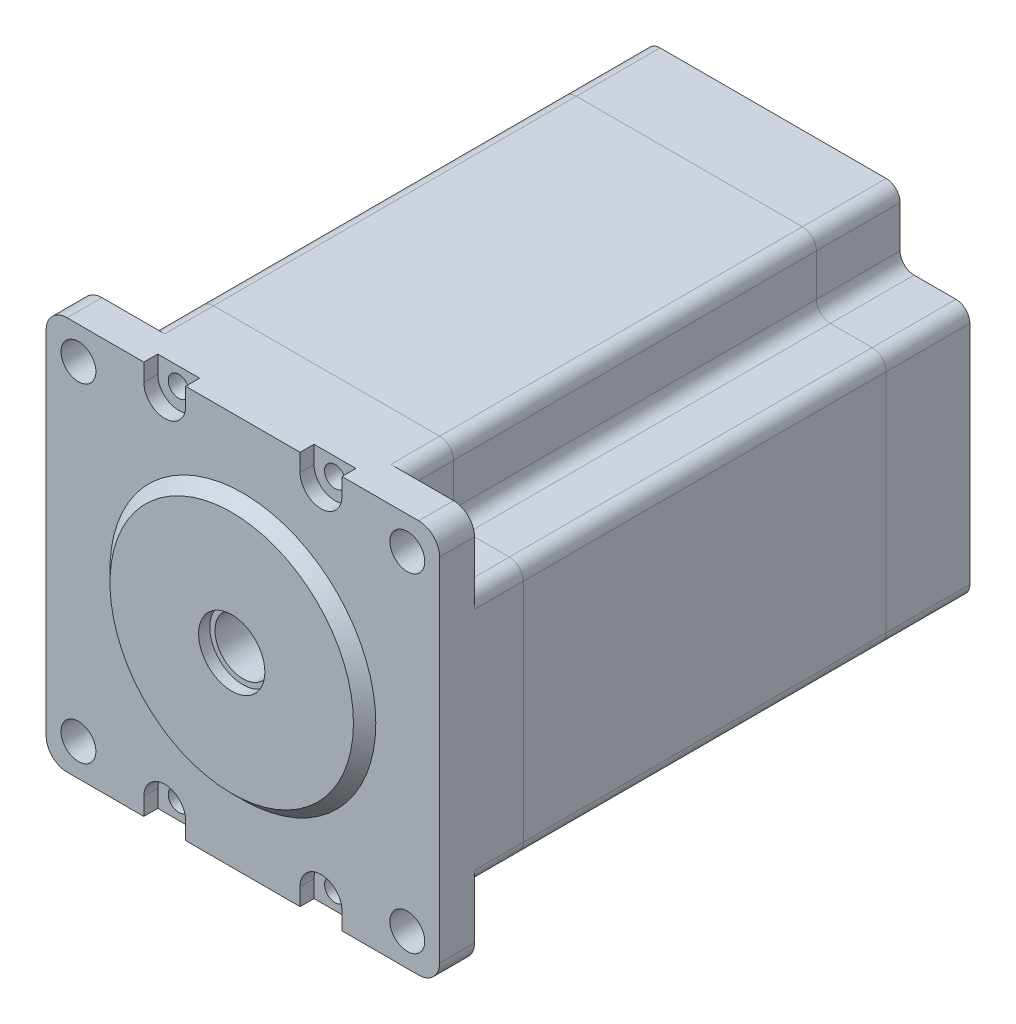
from build123d import *

# Parameters (mm, degrees)
IZIM2_R                     = 2.5
Y_KSEKLIK_EKSTR_ZYON1_DEPTH = 5
Y_KSEKLIK_EKSTR_ZYON2_DEPTH = 7
KES_EKSTR_ZYON1_DEPTH       = 2
IZIM6_R                     = 19.05
Y_KSEKLIK_EKSTR_ZYON3_DEPTH = 1.6
PAH1_SIZE                   = 1.6
Y_KSEKLIK_EKSTR_ZYON5_DEPTH = 52
Y_KSEKLIK_EKSTR_ZYON6_DEPTH = 12
IZIM10_R                    = 1.5
KES_EKSTR_ZYON3_DEPTH       = 10
KES_EKSTR_ZYON4_START       = -77.6
IZIM7_R                     = 4
KES_EKSTR_ZYON4_DEPTH       = 77.6
IZIM11_R                    = 4.75
KES_EKSTR_ZYON5_DEPTH       = 1.6


with BuildPart() as part:
    # Çizim2 → Yükseklik-Ekstrüzyon1 (new body)
    with BuildSketch(Plane.XY):
        with BuildLine():
            Line((-25.2, 28.2), (25.2, 28.2))
            ThreePointArc((25.2, 28.2), (27.321320344, 27.321320344), (28.2, 25.2))
            Line((28.2, 25.2), (28.2, -25.2))
            ThreePointArc((28.2, -25.2), (27.321320344, -27.321320344), (25.2, -28.2))
            Line((25.2, -28.2), (-25.2, -28.2))
            ThreePointArc((-25.2, -28.2), (-27.321320344, -27.321320344), (-28.2, -25.2))
            Line((-28.2, -25.2), (-28.2, 25.2))
            ThreePointArc((-28.2, 25.2), (-27.321320344, 27.321320344), (-25.2, 28.2))
        make_face()
        with Locations((-23.57, 23.57)):
            Circle(IZIM2_R, mode=Mode.SUBTRACT)
        with Locations((23.57, 23.57)):
            Circle(IZIM2_R, mode=Mode.SUBTRACT)
        with Locations(Location((23.57, -23.57, 0), (0, 0, 180))):
            Circle(IZIM2_R, mode=Mode.SUBTRACT)
        with Locations(Location((-23.57, -23.57, 0), (0, 0, 180))):
            Circle(IZIM2_R, mode=Mode.SUBTRACT)
    extrude(amount=Y_KSEKLIK_EKSTR_ZYON1_DEPTH)

    # Çizim4 → Yükseklik-Ekstrüzyon2 (add)
    with BuildSketch(Plane(origin=(0, 0, 0), x_dir=(-1, 0, 0), z_dir=(0, 0, -1))):
        with BuildLine():
            Line((-18.2, 26.2), (-18.2, 20.2))
            ThreePointArc((-18.2, 20.2), (-18.785786438, 18.785786438), (-20.2, 18.2))
            Line((-20.2, 18.2), (-26.2, 18.2))
            ThreePointArc((-26.2, 18.2), (-27.614213562, 17.614213562), (-28.2, 16.2))
            Line((-28.2, 16.2), (-28.2, -16.2))
            ThreePointArc((-28.2, -16.2), (-27.614213562, -17.614213562), (-26.2, -18.2))
            Line((-26.2, -18.2), (-20.2, -18.2))
            ThreePointArc((-20.2, -18.2), (-18.785786438, -18.785786438), (-18.2, -20.2))
            Line((-18.2, -20.2), (-18.2, -26.2))
            ThreePointArc((-18.2, -26.2), (-17.614213562, -27.614213562), (-16.2, -28.2))
            Line((-16.2, -28.2), (16.2, -28.2))
            ThreePointArc((16.2, -28.2), (17.614213562, -27.614213562), (18.2, -26.2))
            Line((18.2, -26.2), (18.2, -20.2))
            ThreePointArc((18.2, -20.2), (18.785786438, -18.785786438), (20.2, -18.2))
            Line((20.2, -18.2), (26.2, -18.2))
            ThreePointArc((26.2, -18.2), (27.614213562, -17.614213562), (28.2, -16.2))
            Line((28.2, -16.2), (28.2, 16.2))
            ThreePointArc((28.2, 16.2), (27.614213562, 17.614213562), (26.2, 18.2))
            Line((26.2, 18.2), (20.2, 18.2))
            ThreePointArc((20.2, 18.2), (18.785786438, 18.785786438), (18.2, 20.2))
            Line((18.2, 20.2), (18.2, 26.2))
            ThreePointArc((18.2, 26.2), (17.614213562, 27.614213562), (16.2, 28.2))
            Line((16.2, 28.2), (-16.2, 28.2))
            ThreePointArc((-16.2, 28.2), (-17.614213562, 27.614213562), (-18.2, 26.2))
        make_face()
    extrude(amount=Y_KSEKLIK_EKSTR_ZYON2_DEPTH)

    # Çizim5 → Kes-Ekstrüzyon1 (cut)
    with BuildSketch(Plane.XY.offset(5)):
        with BuildLine():
            Line((-14.2, 28.2), (-14.2, 25.7))
            ThreePointArc((-14.2, 25.7), (-11.2, 22.7), (-8.2, 25.7))
            Line((-8.2, 25.7), (-8.2, 28.2))
            Line((-8.2, 28.2), (-14.2, 28.2))
        make_face()
        with BuildLine():
            Line((-14.2, -28.2), (-8.2, -28.2))
            Line((-8.2, -28.2), (-8.2, -25.7))
            ThreePointArc((-8.2, -25.7), (-11.2, -22.7), (-14.2, -25.7))
            Line((-14.2, -25.7), (-14.2, -28.2))
        make_face()
        with BuildLine():
            Line((14.2, -28.2), (14.2, -25.7))
            ThreePointArc((14.2, -25.7), (11.2, -22.7), (8.2, -25.7))
            Line((8.2, -25.7), (8.2, -28.2))
            Line((8.2, -28.2), (14.2, -28.2))
        make_face()
        with BuildLine():
            Line((14.2, 28.2), (8.2, 28.2))
            Line((8.2, 28.2), (8.2, 25.7))
            ThreePointArc((8.2, 25.7), (11.2, 22.7), (14.2, 25.7))
            Line((14.2, 25.7), (14.2, 28.2))
        make_face()
    extrude(amount=-KES_EKSTR_ZYON1_DEPTH, mode=Mode.SUBTRACT)

    # Çizim10 → Kes-Ekstrüzyon3 (cut)
    with BuildSketch(Plane.XY.offset(3)):
        with Locations((-11.2, 25.7)):
            Circle(IZIM10_R)
        with Locations(Location((-11.2, -25.7, 0), (0, 0, 180))):
            Circle(IZIM10_R)
        with Locations((11.2, -25.7)):
            Circle(IZIM10_R)
        with Locations(Location((11.2, 25.7, 0), (0, 0, 180))):
            Circle(IZIM10_R)
    extrude(amount=-KES_EKSTR_ZYON3_DEPTH, mode=Mode.SUBTRACT)


with BuildPart() as body_2:
    # Çizim6 → Yükseklik-Ekstrüzyon3 (new body)
    with BuildSketch(Plane.XY.offset(5)):
        Circle(IZIM6_R)
    extrude(amount=Y_KSEKLIK_EKSTR_ZYON3_DEPTH)

    # Pah1
    pah1_edges = [body_2.edges().sort_by_distance(p)[0] for p in [
        (-19.05, 0, 6.6),
    ]]
    chamfer(pah1_edges, length=PAH1_SIZE - 0.0001)  # a hair under: the kernel refuses the full size


with BuildPart() as body_3:
    # Çizim8 → Yükseklik-Ekstrüzyon5 (new body)
    with BuildSketch(Plane(origin=(0, 0, -7), x_dir=(-1, 0, 0), z_dir=(0, 0, -1))):
        with BuildLine():
            Line((-26.2, -18.2), (-20.2, -18.2))
            ThreePointArc((-20.2, -18.2), (-18.785786438, -18.785786438), (-18.2, -20.2))
            Line((-18.2, -20.2), (-18.2, -26.2))
            ThreePointArc((-18.2, -26.2), (-17.614213562, -27.614213562), (-16.2, -28.2))
            Line((-16.2, -28.2), (16.2, -28.2))
            ThreePointArc((16.2, -28.2), (17.614213562, -27.614213562), (18.2, -26.2))
            Line((18.2, -26.2), (18.2, -20.2))
            ThreePointArc((18.2, -20.2), (18.785786438, -18.785786438), (20.2, -18.2))
            Line((20.2, -18.2), (26.2, -18.2))
            ThreePointArc((26.2, -18.2), (27.614213562, -17.614213562), (28.2, -16.2))
            Line((28.2, -16.2), (28.2, 16.2))
            ThreePointArc((28.2, 16.2), (27.614213562, 17.614213562), (26.2, 18.2))
            Line((26.2, 18.2), (20.2, 18.2))
            ThreePointArc((20.2, 18.2), (18.785786438, 18.785786438), (18.2, 20.2))
            Line((18.2, 20.2), (18.2, 26.2))
            ThreePointArc((18.2, 26.2), (17.614213562, 27.614213562), (16.2, 28.2))
            Line((16.2, 28.2), (-16.2, 28.2))
            ThreePointArc((-16.2, 28.2), (-17.614213562, 27.614213562), (-18.2, 26.2))
            Line((-18.2, 26.2), (-18.2, 20.2))
            ThreePointArc((-18.2, 20.2), (-18.785786438, 18.785786438), (-20.2, 18.2))
            Line((-20.2, 18.2), (-26.2, 18.2))
            ThreePointArc((-26.2, 18.2), (-27.614213562, 17.614213562), (-28.2, 16.2))
            Line((-28.2, 16.2), (-28.2, -16.2))
            ThreePointArc((-28.2, -16.2), (-27.614213562, -17.614213562), (-26.2, -18.2))
        make_face()
    extrude(amount=Y_KSEKLIK_EKSTR_ZYON5_DEPTH)


with BuildPart() as body_4:
    # Çizim9 → Yükseklik-Ekstrüzyon6 (new body)
    with BuildSketch(Plane(origin=(0, 0, -59), x_dir=(-1, 0, 0), z_dir=(0, 0, -1))):
        with BuildLine():
            Line((-26.2, -18.2), (-20.2, -18.2))
            ThreePointArc((-20.2, -18.2), (-18.785786438, -18.785786438), (-18.2, -20.2))
            Line((-18.2, -20.2), (-18.2, -26.2))
            ThreePointArc((-18.2, -26.2), (-17.614213562, -27.614213562), (-16.2, -28.2))
            Line((-16.2, -28.2), (16.2, -28.2))
            ThreePointArc((16.2, -28.2), (17.614213562, -27.614213562), (18.2, -26.2))
            Line((18.2, -26.2), (18.2, -20.2))
            ThreePointArc((18.2, -20.2), (18.785786438, -18.785786438), (20.2, -18.2))
            Line((20.2, -18.2), (26.2, -18.2))
            ThreePointArc((26.2, -18.2), (27.614213562, -17.614213562), (28.2, -16.2))
            Line((28.2, -16.2), (28.2, 16.2))
            ThreePointArc((28.2, 16.2), (27.614213562, 17.614213562), (26.2, 18.2))
            Line((26.2, 18.2), (20.2, 18.2))
            ThreePointArc((20.2, 18.2), (18.785786438, 18.785786438), (18.2, 20.2))
            Line((18.2, 20.2), (18.2, 26.2))
            ThreePointArc((18.2, 26.2), (17.614213562, 27.614213562), (16.2, 28.2))
            Line((16.2, 28.2), (-16.2, 28.2))
            ThreePointArc((-16.2, 28.2), (-17.614213562, 27.614213562), (-18.2, 26.2))
            Line((-18.2, 26.2), (-18.2, 20.2))
            ThreePointArc((-18.2, 20.2), (-18.785786438, 18.785786438), (-20.2, 18.2))
            Line((-20.2, 18.2), (-26.2, 18.2))
            ThreePointArc((-26.2, 18.2), (-27.614213562, 17.614213562), (-28.2, 16.2))
            Line((-28.2, 16.2), (-28.2, -16.2))
            ThreePointArc((-28.2, -16.2), (-27.614213562, -17.614213562), (-26.2, -18.2))
        make_face()
    extrude(amount=Y_KSEKLIK_EKSTR_ZYON6_DEPTH)


with BuildPart() as kes_ekstr_zyon4_tool:
    # Çizim7 → Kes-Ekstrüzyon4 (new body)
    with BuildSketch(Plane.XY.offset(6.6).offset(KES_EKSTR_ZYON4_START)):
        with Locations(Location((0, 0, 0), (0, 0, 180))):
            Circle(IZIM7_R)
    extrude(amount=KES_EKSTR_ZYON4_DEPTH)


with BuildPart() as part_1:
    add(part.part)

    # Kes-Ekstrüzyon4: cut by kes_ekstr_zyon4_tool
    add(kes_ekstr_zyon4_tool.part, mode=Mode.SUBTRACT)


with BuildPart() as body_2_1:
    add(body_2.part)

    # Kes-Ekstrüzyon4: cut by kes_ekstr_zyon4_tool
    add(kes_ekstr_zyon4_tool.part, mode=Mode.SUBTRACT)

    # Çizim11 → Kes-Ekstrüzyon5 (cut)
    with BuildSketch(Plane.XY.offset(6.6)):
        Circle(IZIM11_R)
    extrude(amount=-KES_EKSTR_ZYON5_DEPTH, mode=Mode.SUBTRACT)


with BuildPart() as body_3_1:
    add(body_3.part)

    # Kes-Ekstrüzyon4: cut by kes_ekstr_zyon4_tool
    add(kes_ekstr_zyon4_tool.part, mode=Mode.SUBTRACT)


with BuildPart() as body_4_1:
    add(body_4.part)

    # Kes-Ekstrüzyon4: cut by kes_ekstr_zyon4_tool
    add(kes_ekstr_zyon4_tool.part, mode=Mode.SUBTRACT)


solid = Compound([part_1.part, body_2_1.part, body_3_1.part, body_4_1.part])
